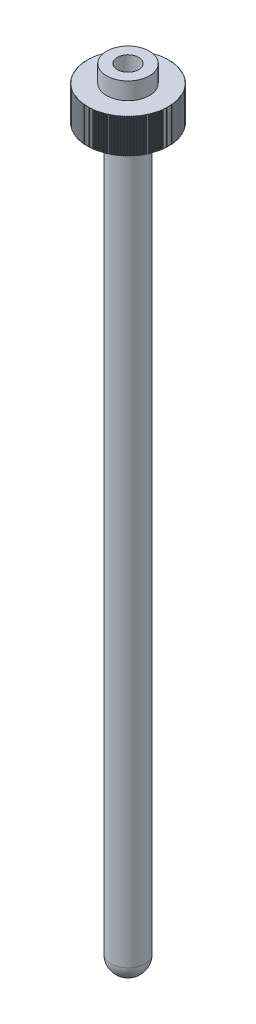
from build123d import *

# Parameters (mm, degrees)
REDONDEO1_R           = 4
CROQUIS3_R            = 2.5
CORTAR_EXTRUIR1_DEPTH = 32
CORTAR_EXTRUIR2_START = -32
CORTAR_EXTRUIR2_DEPTH = 32
MATRIZC1_COUNT        = 200


with BuildPart() as part:
    # Croquis1 → Revolución1 (revolve)
    with BuildSketch(Plane.XY):
        Polygon((0, 0), (0, 184), (5, 184), (5, 180), (9.5, 180), (9.5, 172), (4, 172), (4, 0), align=None)
    revolve(axis=Axis((0, 0, 0), (0, 1, 0)))

    # Redondeo1
    redondeo1_edges = [part.edges().sort_by_distance(p)[0] for p in [
        (-4, 0, 0),
    ]]
    fillet(redondeo1_edges, radius=REDONDEO1_R)

    # Croquis3 → Cortar-Extruir1 (cut)
    with BuildSketch(Plane(origin=(0, 184, 0), x_dir=(1, 0, 0), z_dir=(0, 1, 0))):
        Circle(CROQUIS3_R)
    extrude(amount=-CORTAR_EXTRUIR1_DEPTH, mode=Mode.SUBTRACT)

    # Croquis4 → Cortar-Extruir2 (cut)
    with BuildSketch(Plane(origin=(0, 180, 0), x_dir=(1, 0, 0), z_dir=(0, 1, 0)).offset(CORTAR_EXTRUIR2_START)):
        with BuildLine():
            ThreePointArc((0.133198396, 9.499066174), (0, 9.5), (-0.133198396, 9.499066174))
            Line((-0.133198396, 9.499066174), (0, 9.365867778))
            Line((0, 9.365867778), (0.133198396, 9.499066174))
        make_face()
    cortar_extruir2 = extrude(amount=CORTAR_EXTRUIR2_DEPTH, mode=Mode.SUBTRACT)

    # MatrizC1: Cortar-Extruir2 ×200 about axis
    matrizc1_axis = Axis((0, 0, 0), (0, -1, 0))
    for i in range(1, MATRIZC1_COUNT):
        add(cortar_extruir2.rotate(matrizc1_axis, i * 360 / MATRIZC1_COUNT), mode=Mode.SUBTRACT)


solid = part.part
